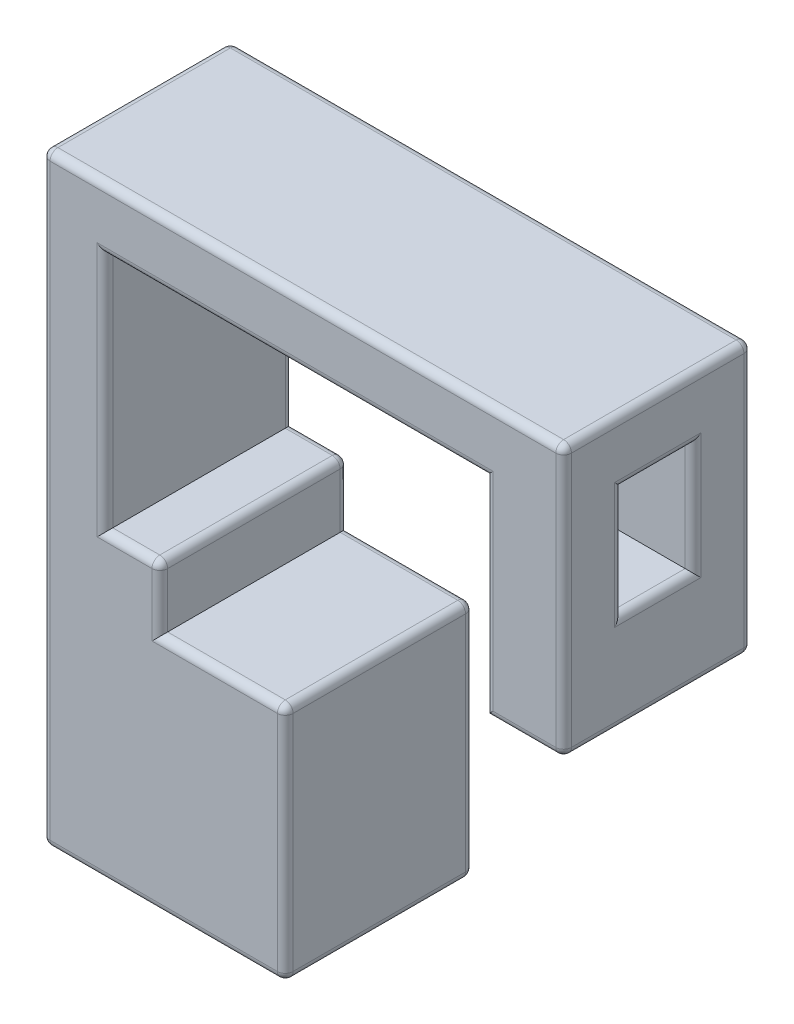
from build123d import *

# Parameters (mm, degrees)
BOSS_EXTRUDE1_DEPTH            = 12
F_4_8_4_8_DIAMETER_HOLE1_D     = 4.8
F_4_8_4_8_DIAMETER_HOLE1_DEPTH = 8
F_4_8_4_8_DIAMETER_HOLE1_TIP   = 1.442065486
F_4_8_4_8_DIAMETER_HOLE2_D     = 4.8
F_4_8_4_8_DIAMETER_HOLE2_DEPTH = 8
F_4_8_4_8_DIAMETER_HOLE2_TIP   = 1.442065486
CUT_EXTRUDE1_REACH             = 104.446
SKETCH11_W                     = 9
SKETCH11_H                     = 14
FILLET1_R                      = 1


with BuildPart() as part:
    # Sketch1 → Boss-Extrude1 (new, symmetric)
    with BuildSketch(Plane.XY):
        Polygon((0, 0), (-23, 0), (-31, 0), (-31, 77), (-23.404895261, 77), (35.5, 77), (35.5, 42.5), (25.5, 42.5), (25.5, 69), (-23, 69), (-23, 38.5), (-16, 38.5), (-16, 30.5), (0, 30.5), align=None)
    extrude(amount=BOSS_EXTRUDE1_DEPTH, both=True)

    # Ø4.8 (4.8) Diameter Hole1
    with Locations(Plane(origin=(0, 42.5, 0), x_dir=(-1, 0, 0), z_dir=(0, -1, 0))):
        with Locations((-29.8, 4.75), (-29.8, -4.75)):
            Hole(F_4_8_4_8_DIAMETER_HOLE1_D / 2, depth=F_4_8_4_8_DIAMETER_HOLE1_DEPTH)
            with Locations((0, 0, -(F_4_8_4_8_DIAMETER_HOLE1_DEPTH + F_4_8_4_8_DIAMETER_HOLE1_TIP / 2))):  # 118° drill point
                Cone(0, F_4_8_4_8_DIAMETER_HOLE1_D / 2, F_4_8_4_8_DIAMETER_HOLE1_TIP, mode=Mode.SUBTRACT)

    # Ø4.8 (4.8) Diameter Hole2
    with Locations(Plane(origin=(0, 0, 0), x_dir=(-1, 0, 0), z_dir=(0, -1, 0))):
        with Locations((7.5, 0), (23.5, 0)):
            Hole(F_4_8_4_8_DIAMETER_HOLE2_D / 2, depth=F_4_8_4_8_DIAMETER_HOLE2_DEPTH)
            with Locations((0, 0, -(F_4_8_4_8_DIAMETER_HOLE2_DEPTH + F_4_8_4_8_DIAMETER_HOLE2_TIP / 2))):  # 118° drill point
                Cone(0, F_4_8_4_8_DIAMETER_HOLE2_D / 2, F_4_8_4_8_DIAMETER_HOLE2_TIP, mode=Mode.SUBTRACT)

    # Sketch11 → Cut-Extrude1 (cut, up to next)
    with BuildSketch(Plane(origin=(35.5, 0, 0), x_dir=(0, 0, -1), z_dir=(1, 0, 0)), mode=Mode.PRIVATE) as cut_extrude1_sk1:
        with Locations((0, 62)):
            Rectangle(SKETCH11_W, SKETCH11_H)
    cut_extrude1_tool1 = extrude(cut_extrude1_sk1.sketch, amount=-CUT_EXTRUDE1_REACH, mode=Mode.PRIVATE) & part.part
    add(cut_extrude1_tool1.solids().sort_by_distance((35.5, 62, 0))[0], mode=Mode.SUBTRACT)

    # Fillet1
    fillet1_edges = [part.edges().sort_by_distance(p)[0] for p in [
        (0, 0, 0),
        (0, 30.5, 0),
        (-8, 30.5, -12),
        (-16, 34.5, -12),
        (-19.5, 38.5, -12),
        (-23, 53.75, -12),
        (1.25, 69, -12),
        (25.5, 55.75, -12),
        (30.5, 42.5, -12),
        (35.5, 59.75, -12),
        (2.25, 77, -12),
        (-15.5, 0, -12),
        (0, 15.25, -12),
        (-31, 77, 0),
        (-31, 0, 0),
        (-31, 38.5, -12),
        (-15.5, 0, 12),
        (-31, 38.5, 12),
        (2.25, 77, 12),
        (35.5, 59.75, 12),
        (30.5, 42.5, 12),
        (25.5, 55.75, 12),
        (1.25, 69, 12),
        (-23, 53.75, 12),
        (-19.5, 38.5, 12),
        (-16, 34.5, 12),
        (-8, 30.5, 12),
        (0, 15.25, 12),
        (-16, 38.5, 0),
        (35.5, 77, 0),
        (35.5, 42.5, 0),
        (35.5, 62, -4.5),
        (35.5, 69, 0),
        (35.5, 62, 4.5),
        (35.5, 55, 0),
    ]]
    fillet(fillet1_edges, radius=FILLET1_R)


solid = part.part
